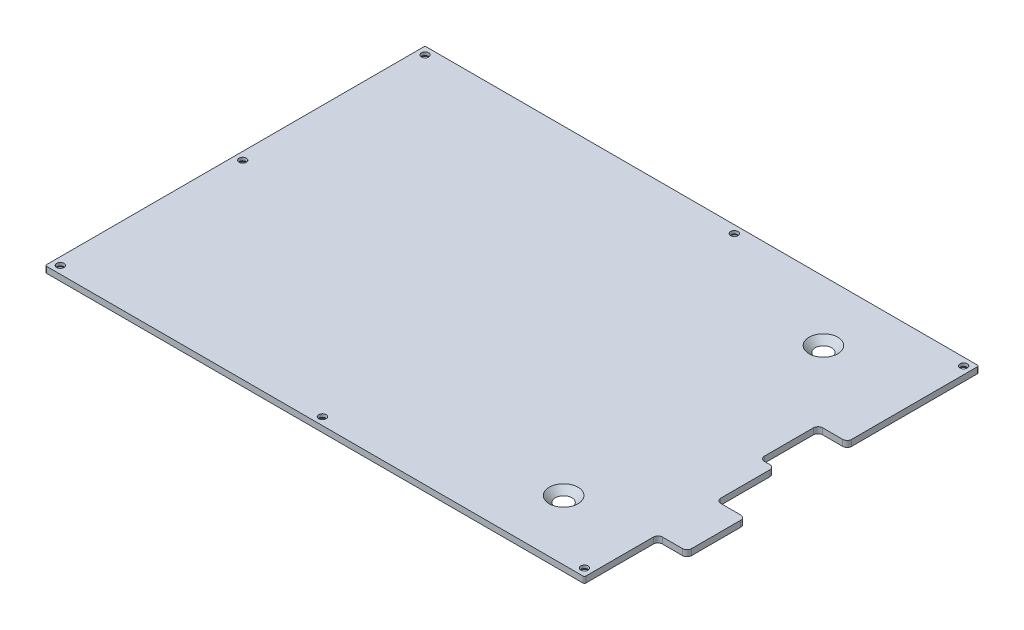
from build123d import *

# Parameters (mm, degrees)
PLATE_FRAME_DEPTH                              = 2
CSK_FOR_M2_FLAT_HEAD_MACHINE_SCREW2_AT_2_COUNT = 2
CSK_FOR_M2_FLAT_HEAD_MACHINE_SCREW2_AT_2_PITCH = 75
CSK_FOR_M2_FLAT_HEAD_MACHINE_SCREW2_AT_3_COUNT = 2
CSK_FOR_M2_FLAT_HEAD_MACHINE_SCREW2_AT_3_PITCH = 176.2125
CSK_FOR_M2_FLAT_HEAD_MACHINE_SCREW2_AT_4_COUNT = 2
CSK_FOR_M2_FLAT_HEAD_MACHINE_SCREW2_AT_4_PITCH = 186.034856025
CSK_FOR_M2_FLAT_HEAD_MACHINE_SCREW2_AT_5_COUNT = 2
CSK_FOR_M2_FLAT_HEAD_MACHINE_SCREW2_AT_5_PITCH = 212.798813804
CSK_FOR_M2_FLAT_HEAD_MACHINE_SCREW2_AT_6_COUNT = 2
CSK_FOR_M2_FLAT_HEAD_MACHINE_SCREW2_AT_6_PITCH = 149.734690891
CSK_FOR_M2_FLAT_HEAD_MACHINE_SCREW2_AT_7_COUNT = 2
CSK_FOR_M2_FLAT_HEAD_MACHINE_SCREW2_AT_7_PITCH = 119.395022535
CSK_FOR_M4_FLAT_HEAD_MACHINE_SCREW1_AT_2_COUNT = 2
CSK_FOR_M4_FLAT_HEAD_MACHINE_SCREW1_AT_2_PITCH = 85
FILLET3_R                                      = 1.5
FILLET4_R                                      = 0.5


with BuildPart() as part:
    # Sketch1 → Plate Frame (new body)
    with BuildSketch(Plane(origin=(0, 0, 0), x_dir=(1, 0, 0), z_dir=(0, 1, 0))):
        Polygon((0, 0), (0, 124.3), (181.2125, 124.3), (181.2125, 81.2), (171.6875, 81.2), (171.6875, 62.15), (176.45, 62.15), (176.45, 43.1), (185.975, 43.1), (185.975, 24.05), (176.45, 24.05), (176.45, 0), align=None)
    extrude(amount=PLATE_FRAME_DEPTH)

    # Sketch23 → CSK for M2 Flat Head Machine Screw2 (revolve, cut)
    with BuildSketch(Plane(origin=(178.7125, 0, -121.8), x_dir=(0, 0, -1), z_dir=(1, 0, 0))):
        Polygon((0, 0), (0, 2), (1.2, 2), (1.2, 1), (2.2, 0), align=None)
    csk_for_m2_flat_head_machine_screw2 = revolve(axis=Axis((178.7125, -6.35, -121.8), (0, 1, 0)), mode=Mode.SUBTRACT)

    # CSK for M2 Flat Head Machine Screw2 at 2: CSK for M2 Flat Head Machine Screw2 ×2
    with Locations(*[(-i * CSK_FOR_M2_FLAT_HEAD_MACHINE_SCREW2_AT_2_PITCH, 0, 0) for i in range(1, CSK_FOR_M2_FLAT_HEAD_MACHINE_SCREW2_AT_2_COUNT)]):
        add(csk_for_m2_flat_head_machine_screw2, mode=Mode.SUBTRACT)

    # CSK for M2 Flat Head Machine Screw2 at 3: CSK for M2 Flat Head Machine Screw2 ×2
    with Locations(*[(-i * CSK_FOR_M2_FLAT_HEAD_MACHINE_SCREW2_AT_3_PITCH, 0, 0) for i in range(1, CSK_FOR_M2_FLAT_HEAD_MACHINE_SCREW2_AT_3_COUNT)]):
        add(csk_for_m2_flat_head_machine_screw2, mode=Mode.SUBTRACT)

    # CSK for M2 Flat Head Machine Screw2 at 4: CSK for M2 Flat Head Machine Screw2 ×2
    with Locations(*[Vector(-0.9472015286011822, 0, 0.3206388376594201) * (i * CSK_FOR_M2_FLAT_HEAD_MACHINE_SCREW2_AT_4_PITCH) for i in range(1, CSK_FOR_M2_FLAT_HEAD_MACHINE_SCREW2_AT_4_COUNT)]):
        add(csk_for_m2_flat_head_machine_screw2, mode=Mode.SUBTRACT)

    # CSK for M2 Flat Head Machine Screw2 at 5: CSK for M2 Flat Head Machine Screw2 ×2
    with Locations(*[Vector(-0.828070875256726, 0, 0.5606234257962827) * (i * CSK_FOR_M2_FLAT_HEAD_MACHINE_SCREW2_AT_5_PITCH) for i in range(1, CSK_FOR_M2_FLAT_HEAD_MACHINE_SCREW2_AT_5_COUNT)]):
        add(csk_for_m2_flat_head_machine_screw2, mode=Mode.SUBTRACT)

    # CSK for M2 Flat Head Machine Screw2 at 6: CSK for M2 Flat Head Machine Screw2 ×2
    with Locations(*[Vector(-0.6043188753487793, 0, 0.7967425537130464) * (i * CSK_FOR_M2_FLAT_HEAD_MACHINE_SCREW2_AT_6_PITCH) for i in range(1, CSK_FOR_M2_FLAT_HEAD_MACHINE_SCREW2_AT_6_COUNT)]):
        add(csk_for_m2_flat_head_machine_screw2, mode=Mode.SUBTRACT)

    # CSK for M2 Flat Head Machine Screw2 at 7: CSK for M2 Flat Head Machine Screw2 ×2
    with Locations(*[Vector(-0.039888597521597645, 0, 0.9992041331918919) * (i * CSK_FOR_M2_FLAT_HEAD_MACHINE_SCREW2_AT_7_PITCH) for i in range(1, CSK_FOR_M2_FLAT_HEAD_MACHINE_SCREW2_AT_7_COUNT)]):
        add(csk_for_m2_flat_head_machine_screw2, mode=Mode.SUBTRACT)

    # Sketch26 → CSK for M4 Flat Head Machine Screw1 (revolve, cut)
    with BuildSketch(Plane(origin=(150, 2, -104.65), x_dir=(0, 0, 1), z_dir=(1, 0, 0))):
        Polygon((0, 0), (0, 2), (2.25, 2), (2.25, 2.45), (4.7, 0), align=None)
    csk_for_m4_flat_head_machine_screw1 = revolve(axis=Axis((150, 8.35, -104.65), (0, -1, 0)), mode=Mode.SUBTRACT)

    # CSK for M4 Flat Head Machine Screw1 at 2: CSK for M4 Flat Head Machine Screw1 ×2
    with Locations(*[(0, 0, i * CSK_FOR_M4_FLAT_HEAD_MACHINE_SCREW1_AT_2_PITCH) for i in range(1, CSK_FOR_M4_FLAT_HEAD_MACHINE_SCREW1_AT_2_COUNT)]):
        add(csk_for_m4_flat_head_machine_screw1, mode=Mode.SUBTRACT)

    # Fillet3
    fillet3_edges = [part.edges().sort_by_distance(p)[0] for p in [
        (171.6875, 1, -81.2),
        (181.2125, 1, -81.2),
        (176.45, 1, -62.15),
        (171.6875, 1, -62.15),
        (176.45, 1, -43.1),
        (185.975, 1, -43.1),
        (185.975, 1, -24.05),
        (176.45, 1, -24.05),
    ]]
    fillet(fillet3_edges, radius=FILLET3_R)

    # Fillet4
    fillet4_edges = [part.edges().sort_by_distance(p)[0] for p in [
        (181.2125, 1, -124.3),
        (0, 1, 0),
        (176.45, 1, 0),
        (0, 1, -124.3),
    ]]
    fillet(fillet4_edges, radius=FILLET4_R)


solid = part.part
